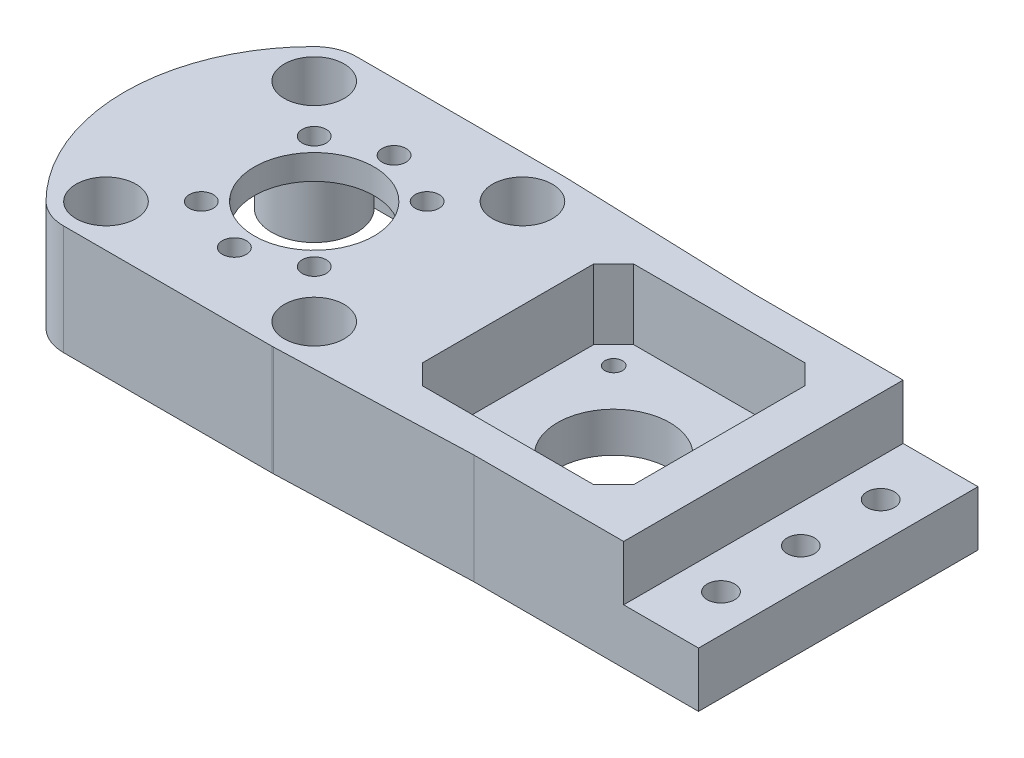
from build123d import *

# Parameters (mm, degrees)
SKETCH_1_R                   = 38
SKETCH_1_R_2                 = 12
SKETCH_1_R_3                 = 2.4
SKETCH_1_R_4                 = 3.1
EXTRUDE_1_DEPTH              = 5
SKETCH_2_R                   = 8.5
EXTRUDE_2_DEPTH              = 17
SKETCH_3_R                   = 6
CUT_EXTRUDE_1_DEPTH          = 19
CUT_EXTRUDE_2_REACH          = 59
SKETCH_4_R                   = 3.1
CUT_EXTRUDE_START            = 6
CUT_EXTRUDE_3_DEPTH          = 6
EXTRUDE_START                = -22
EXTRUDE_5_DEPTH              = 22
SKETCH_9_W                   = 41.71930009
SKETCH_9_H                   = 2.5
EXTRUDE_6_DEPTH              = 17
CUT_EXTRUDE_4_REACH          = 122.848
SKETCH_10_W                  = 15
SKETCH_10_H                  = 11
SKETCH_11_W                  = 42.3
SKETCH_11_H                  = 42.3
SKETCH_11_R                  = 11.25
CUT_EXTRUDE_5_DEPTH          = 14
CUT_EXTRUDE_6_REACH          = 113.225
SKETCH_11_2_R                = 1.75
SKETCH_11_2_R_2              = 11.25
CHAMFER_2_SIZE               = 4
HOLE_WIZARD_M5_2_D           = 5.5
HOLE_WIZARD_M5_2_CBORE_D     = 11
HOLE_WIZARD_M5_2_CBORE_DEPTH = 0.5
SKETCH_13_R                  = 3
CUT_EXTRUDE_7_DEPTH          = 3


# Read off the part's stored shape, not the designer's step: 凸台-拉伸5
with BuildPart() as part:
    # 草图1 → 凸台-拉伸1 (new body)
    with BuildSketch(Plane(origin=(0, 0, 0), x_dir=(1, 0, 0), z_dir=(0, 1, 0))):
        with Locations(Location((0, 0, 0), (0, 0, 270))):
            Circle(SKETCH_1_R)
        with Locations(Location((0, 0, 0), (0, 0, 270))):
            Circle(SKETCH_1_R_2, mode=Mode.SUBTRACT)
        with Locations(Location((-11.313708499, 11.313708499, 0), (0, 0, 270))):
            Circle(SKETCH_1_R_3, mode=Mode.SUBTRACT)
        with Locations(Location((0, 16, 0), (0, 0, 270))):
            Circle(SKETCH_1_R_3, mode=Mode.SUBTRACT)
        with Locations(Location((11.313708499, 11.313708499, 0), (0, 0, 270))):
            Circle(SKETCH_1_R_3, mode=Mode.SUBTRACT)
        with Locations(Location((11.313708499, -11.313708499, 0), (0, 0, 90))):
            Circle(SKETCH_1_R_3, mode=Mode.SUBTRACT)
        with Locations(Location((-11.313708499, -11.313708499, 0), (0, 0, 90))):
            Circle(SKETCH_1_R_3, mode=Mode.SUBTRACT)
        with Locations(Location((0, -16, 0), (0, 0, 90))):
            Circle(SKETCH_1_R_3, mode=Mode.SUBTRACT)
        with Locations(Location((-20.859650045, 20.859650045, 0), (0, 0, 270))):
            Circle(SKETCH_1_R_4, mode=Mode.SUBTRACT)
        with Locations(Location((20.859650045, 20.859650045, 0), (0, 0, 270))):
            Circle(SKETCH_1_R_4, mode=Mode.SUBTRACT)
        with Locations(Location((20.859650045, -20.859650045, 0), (0, 0, 270))):
            Circle(SKETCH_1_R_4, mode=Mode.SUBTRACT)
        with Locations(Location((-20.859650045, -20.859650045, 0), (0, 0, 270))):
            Circle(SKETCH_1_R_4, mode=Mode.SUBTRACT)
    extrude(amount=EXTRUDE_1_DEPTH)

    # 草图2 → 凸台-拉伸2 (add)
    with BuildSketch(Plane(origin=(0, 0, 0), x_dir=(1, 0, 0), z_dir=(0, 1, 0))):
        with Locations(Location((-20.859650045, 20.859650045, 0), (0, 0, 270))):
            Circle(SKETCH_2_R)
        with Locations(Location((20.859650045, 20.859650045, 0), (0, 0, 270))):
            Circle(SKETCH_2_R)
        with Locations(Location((20.859650045, -20.859650045, 0), (0, 0, 270))):
            Circle(SKETCH_2_R)
        with Locations(Location((-20.859650045, -20.859650045, 0), (0, 0, 270))):
            Circle(SKETCH_2_R)
    extrude(amount=-EXTRUDE_2_DEPTH)

    # 草图3 → 切除-拉伸1 (cut)
    with BuildSketch(Plane(origin=(0, 5, 0), x_dir=(1, 0, 0), z_dir=(0, 1, 0))):
        with Locations(Location((-20.859650045, 20.859650045, 0), (0, 0, 270))):
            Circle(SKETCH_3_R)
        with Locations(Location((20.859650045, 20.859650045, 0), (0, 0, 270))):
            Circle(SKETCH_3_R)
        with Locations(Location((20.859650045, -20.859650045, 0), (0, 0, 270))):
            Circle(SKETCH_3_R)
        with Locations(Location((-20.859650045, -20.859650045, 0), (0, 0, 270))):
            Circle(SKETCH_3_R)
    extrude(amount=-CUT_EXTRUDE_1_DEPTH, mode=Mode.SUBTRACT)

    # 草图4 → 切除-拉伸2 (cut, up to next)
    with BuildSketch(Plane(origin=(0, -14, 0), x_dir=(1, 0, 0), z_dir=(0, 1, 0)), mode=Mode.PRIVATE) as cut_extrude_2_sk1:
        with Locations(Location((-20.859650045, 20.859650045, 0), (0, 0, 270))):
            Circle(SKETCH_4_R)
    cut_extrude_2_tool1 = extrude(cut_extrude_2_sk1.sketch, amount=-CUT_EXTRUDE_2_REACH, mode=Mode.PRIVATE) & part.part
    # 草图4 → 切除-拉伸2 (cut, up to next)
    with BuildSketch(Plane(origin=(0, -14, 0), x_dir=(1, 0, 0), z_dir=(0, 1, 0)), mode=Mode.PRIVATE) as cut_extrude_2_sk2:
        with Locations(Location((20.859650045, 20.859650045, 0), (0, 0, 270))):
            Circle(SKETCH_4_R)
    cut_extrude_2_tool2 = extrude(cut_extrude_2_sk2.sketch, amount=-CUT_EXTRUDE_2_REACH, mode=Mode.PRIVATE) & part.part
    # 草图4 → 切除-拉伸2 (cut, up to next)
    with BuildSketch(Plane(origin=(0, -14, 0), x_dir=(1, 0, 0), z_dir=(0, 1, 0)), mode=Mode.PRIVATE) as cut_extrude_2_sk3:
        with Locations(Location((20.859650045, -20.859650045, 0), (0, 0, 270))):
            Circle(SKETCH_4_R)
    cut_extrude_2_tool3 = extrude(cut_extrude_2_sk3.sketch, amount=-CUT_EXTRUDE_2_REACH, mode=Mode.PRIVATE) & part.part
    # 草图4 → 切除-拉伸2 (cut, up to next)
    with BuildSketch(Plane(origin=(0, -14, 0), x_dir=(1, 0, 0), z_dir=(0, 1, 0)), mode=Mode.PRIVATE) as cut_extrude_2_sk4:
        with Locations(Location((-20.859650045, -20.859650045, 0), (0, 0, 270))):
            Circle(SKETCH_4_R)
    cut_extrude_2_tool4 = extrude(cut_extrude_2_sk4.sketch, amount=-CUT_EXTRUDE_2_REACH, mode=Mode.PRIVATE) & part.part
    add(cut_extrude_2_tool1.solids().sort_by_distance((-20.85965, -14, -20.85965))[0], mode=Mode.SUBTRACT)
    add(cut_extrude_2_tool2.solids().sort_by_distance((20.85965, -14, -20.85965))[0], mode=Mode.SUBTRACT)
    add(cut_extrude_2_tool3.solids().sort_by_distance((20.85965, -14, 20.85965))[0], mode=Mode.SUBTRACT)
    add(cut_extrude_2_tool4.solids().sort_by_distance((-20.85965, -14, 20.85965))[0], mode=Mode.SUBTRACT)

    # 草图7 → 切除-拉伸3 (cut)
    with BuildSketch(Plane(origin=(0, 0, 0), x_dir=(1, 0, 0), z_dir=(0, 1, 0)).offset(CUT_EXTRUDE_START)):
        with BuildLine():
            Line((-20.859650045, -29.359650045), (20.859650045, -29.359650045))
            ThreePointArc((20.859650045, -29.359650045), (24.11245922, -28.712626071), (26.870057685, -26.870057685))
            ThreePointArc((26.870057685, -26.870057685), (0, -38), (-26.870057685, -26.870057685))
            ThreePointArc((-26.870057685, -26.870057685), (-24.11245922, -28.712626071), (-20.859650045, -29.359650045))
        make_face()
        with BuildLine():
            Line((-20.859650045, 29.359650045), (20.859650045, 29.359650045))
            ThreePointArc((20.859650045, 29.359650045), (24.11245922, 28.712626071), (26.870057685, 26.870057685))
            ThreePointArc((26.870057685, 26.870057685), (0, 38), (-26.870057685, 26.870057685))
            ThreePointArc((-26.870057685, 26.870057685), (-24.11245922, 28.712626071), (-20.859650045, 29.359650045))
        make_face()
    extrude(amount=-CUT_EXTRUDE_3_DEPTH, mode=Mode.SUBTRACT)

    # 凸台-拉伸5 outline → 凸台-拉伸5 (add)
    with BuildSketch(Plane(origin=(0, 5, 0), x_dir=(1, 0, 0), z_dir=(0, 1, 0)).offset(EXTRUDE_START)):
        with BuildLine():
            ThreePointArc((-26.870057685, 26.870057685), (-38, 0), (-26.870057685, -26.870057685))
            ThreePointArc((-26.870057685, -26.870057685), (-28.864243736, -23.719104512), (-29.317860266, -20.017818797))
            ThreePointArc((-29.317860266, -20.017818797), (-35.5, 0), (-29.317860266, 20.017818797))
            ThreePointArc((-29.317860266, 20.017818797), (-28.864243736, 23.719104512), (-26.870057685, 26.870057685))
        make_face()
        with BuildLine():
            ThreePointArc((28.135986341, 16.465912444), (32.6, 0), (28.135986341, -16.465912444))
            ThreePointArc((28.135986341, -16.465912444), (28.333920326, -24.907524026), (21.155863292, -29.354487166))
            Line((21.155863292, -29.354487166), (60, -28))
            Line((60, -28), (105, -28))
            Line((105, -28), (105, 28))
            Line((105, 28), (60, 28))
            Line((60, 28), (21.155863292, 29.354487166))
            ThreePointArc((21.155863292, 29.354487166), (28.333920326, 24.907524026), (28.135986341, 16.465912444))
        make_face()
    extrude(amount=EXTRUDE_5_DEPTH)

    # 草图9 → 凸台-拉伸6 (add)
    with BuildSketch(Plane.XZ):
        with Locations((0, 28.109650045)):
            Rectangle(SKETCH_9_W, SKETCH_9_H)
        with Locations((0, -28.109650045)):
            Rectangle(SKETCH_9_W, SKETCH_9_H)
    extrude(amount=EXTRUDE_6_DEPTH)

    # 草图10 → 切除-拉伸4 (cut, up to next)
    with BuildSketch(Plane.XY.offset(28), mode=Mode.PRIVATE) as cut_extrude_4_sk1:
        with Locations((97.5, -0.5)):
            Rectangle(SKETCH_10_W, SKETCH_10_H)
    cut_extrude_4_tool1 = extrude(cut_extrude_4_sk1.sketch, amount=-CUT_EXTRUDE_4_REACH, mode=Mode.PRIVATE) & part.part
    add(cut_extrude_4_tool1.solids().sort_by_distance((97.5, -0.5, 28))[0], mode=Mode.SUBTRACT)

    # 草图11 → 切除-拉伸5 (cut)
    with BuildSketch(Plane(origin=(0, 5, 0), x_dir=(1, 0, 0), z_dir=(0, 1, 0))):
        with Locations((60, 0)):
            Rectangle(SKETCH_11_W, SKETCH_11_H)
        with Locations(Location((60, 0, 0), (0, 0, 270))):
            Circle(SKETCH_11_R, mode=Mode.SUBTRACT)
    extrude(amount=-CUT_EXTRUDE_5_DEPTH, mode=Mode.SUBTRACT)

    # 草图11<2> → 切除-拉伸6 (cut, up to next)
    with BuildSketch(Plane(origin=(0, 5, 0), x_dir=(1, 0, 0), z_dir=(0, 1, 0)), mode=Mode.PRIVATE) as cut_extrude_6_sk1:
        with Locations(Location((44.5, 15.5, 0), (0, 0, 270))):
            Circle(SKETCH_11_2_R)
    cut_extrude_6_tool1 = extrude(cut_extrude_6_sk1.sketch, amount=-CUT_EXTRUDE_6_REACH, mode=Mode.PRIVATE) & part.part
    # 草图11<2> → 切除-拉伸6 (cut, up to next)
    with BuildSketch(Plane(origin=(0, 5, 0), x_dir=(1, 0, 0), z_dir=(0, 1, 0)), mode=Mode.PRIVATE) as cut_extrude_6_sk2:
        with Locations(Location((60, 0, 0), (0, 0, 270))):
            Circle(SKETCH_11_2_R_2)
    cut_extrude_6_tool2 = extrude(cut_extrude_6_sk2.sketch, amount=-CUT_EXTRUDE_6_REACH, mode=Mode.PRIVATE) & part.part
    # 草图11<2> → 切除-拉伸6 (cut, up to next)
    with BuildSketch(Plane(origin=(0, 5, 0), x_dir=(1, 0, 0), z_dir=(0, 1, 0)), mode=Mode.PRIVATE) as cut_extrude_6_sk3:
        with Locations(Location((75.5, 15.5, 0), (0, 0, 270))):
            Circle(SKETCH_11_2_R)
    cut_extrude_6_tool3 = extrude(cut_extrude_6_sk3.sketch, amount=-CUT_EXTRUDE_6_REACH, mode=Mode.PRIVATE) & part.part
    # 草图11<2> → 切除-拉伸6 (cut, up to next)
    with BuildSketch(Plane(origin=(0, 5, 0), x_dir=(1, 0, 0), z_dir=(0, 1, 0)), mode=Mode.PRIVATE) as cut_extrude_6_sk4:
        with Locations(Location((75.5, -15.5, 0), (0, 0, 270))):
            Circle(SKETCH_11_2_R)
    cut_extrude_6_tool4 = extrude(cut_extrude_6_sk4.sketch, amount=-CUT_EXTRUDE_6_REACH, mode=Mode.PRIVATE) & part.part
    # 草图11<2> → 切除-拉伸6 (cut, up to next)
    with BuildSketch(Plane(origin=(0, 5, 0), x_dir=(1, 0, 0), z_dir=(0, 1, 0)), mode=Mode.PRIVATE) as cut_extrude_6_sk5:
        with Locations(Location((44.5, -15.5, 0), (0, 0, 270))):
            Circle(SKETCH_11_2_R)
    cut_extrude_6_tool5 = extrude(cut_extrude_6_sk5.sketch, amount=-CUT_EXTRUDE_6_REACH, mode=Mode.PRIVATE) & part.part
    add(cut_extrude_6_tool1.solids().sort_by_distance((44.5, 5, -15.5))[0], mode=Mode.SUBTRACT)
    add(cut_extrude_6_tool2.solids().sort_by_distance((60, 5, 0))[0], mode=Mode.SUBTRACT)
    add(cut_extrude_6_tool3.solids().sort_by_distance((75.5, 5, -15.5))[0], mode=Mode.SUBTRACT)
    add(cut_extrude_6_tool4.solids().sort_by_distance((75.5, 5, 15.5))[0], mode=Mode.SUBTRACT)
    add(cut_extrude_6_tool5.solids().sort_by_distance((44.5, 5, 15.5))[0], mode=Mode.SUBTRACT)

    # 倒角2
    chamfer_2_edges = [part.edges().sort_by_distance(p)[0] for p in [
        (38.85, -2, -21.15),
        (81.15, -2, -21.15),
        (81.15, -2, 21.15),
        (38.85, -2, 21.15),
    ]]
    chamfer(chamfer_2_edges, length=CHAMFER_2_SIZE)

    # M5 六角头螺栓的柱形沉头孔2 (through all)
    with Locations(Plane(origin=(0, -17, 0), x_dir=(-1, 0, 0), z_dir=(0, -1, 0))):
        with Locations((-97.5, -16), (-97.5, 0), (-97.5, 16)):
            CounterBoreHole(HOLE_WIZARD_M5_2_D / 2, HOLE_WIZARD_M5_2_CBORE_D / 2, HOLE_WIZARD_M5_2_CBORE_DEPTH)

    # 草图13 → 切除-拉伸7 (cut)
    with BuildSketch(Plane.XZ.offset(17)):
        with Locations(Location((44.5, 15.5, 0), (0, 0, 270))):
            Circle(SKETCH_13_R)
        with Locations(Location((75.5, 15.5, 0), (0, 0, 270))):
            Circle(SKETCH_13_R)
        with Locations(Location((75.5, -15.5, 0), (0, 0, 270))):
            Circle(SKETCH_13_R)
        with Locations(Location((44.5, -15.5, 0), (0, 0, 270))):
            Circle(SKETCH_13_R)
    extrude(amount=-CUT_EXTRUDE_7_DEPTH, mode=Mode.SUBTRACT)


solid = part.part
